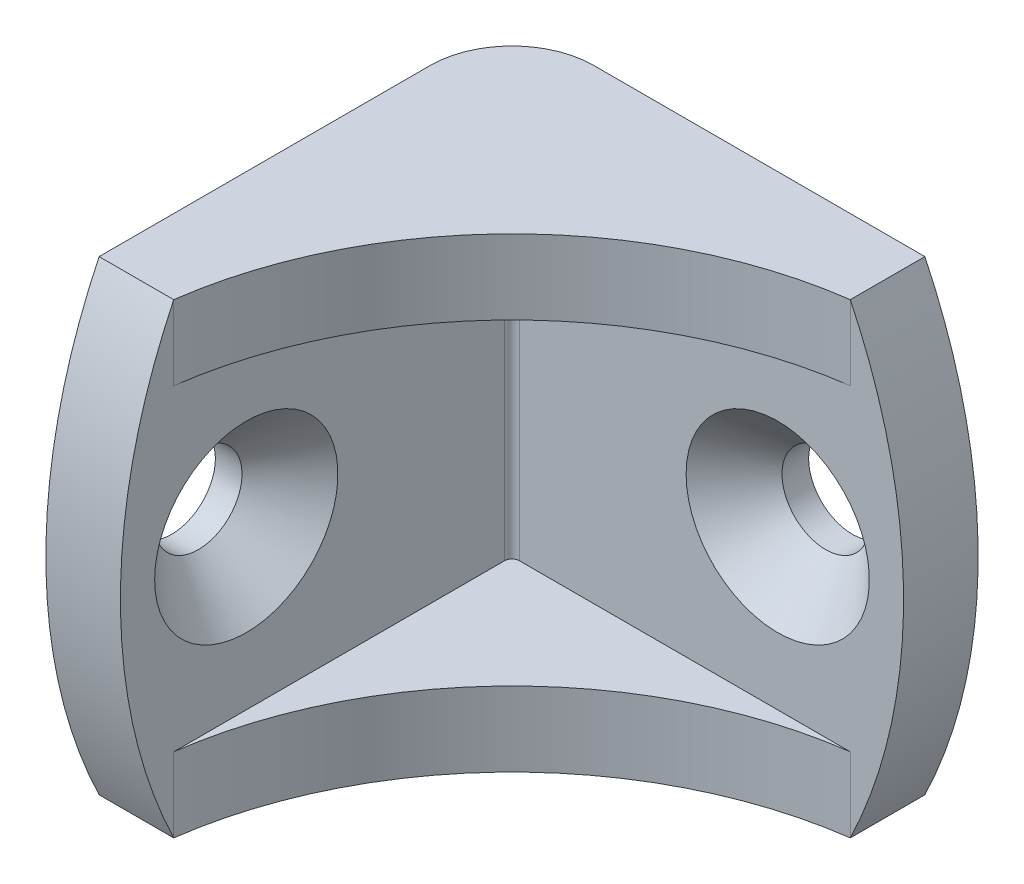
from build123d import *

# Parameters (mm, degrees)
EXTRUDE_THIN1_START = -11.1125
EXTRUDE_THIN1_DEPTH = 22.225
EXTRUDE4_START      = -3.556
EXTRUDE4_DEPTH      = 3.556
SKETCH4_R           = 2.0828
CUT_EXTRUDE1_DEPTH  = 34.3375
CUT_EXTRUDE2_DEPTH  = 32.080055377
CHAMFER1_SIZE       = 2.286


# Read off the part's stored shape, not the designer's step: Extrude-Thin1
with BuildPart() as part:
    # Extrude-Thin1 outline → Extrude-Thin1 (new body)
    with BuildSketch(Plane(origin=(0, 0, 0), x_dir=(1, 0, 0), z_dir=(0, 1, 0)).offset(EXTRUDE_THIN1_START)):
        with BuildLine():
            Line((3.9116, -3.556), (22.225, -3.556))
            Line((22.225, -3.556), (22.225, 0))
            Line((22.225, 0), (3.9116, 0))
            ThreePointArc((3.9116, 0), (1.145681115, -1.145681115), (0, -3.9116))
            Line((0, -3.9116), (0, -22.225))
            Line((0, -22.225), (3.556, -22.225))
            Line((3.556, -22.225), (3.556, -3.9116))
            ThreePointArc((3.556, -3.9116), (3.660152829, -3.660152829), (3.9116, -3.556))
        make_face()
    extrude(amount=EXTRUDE_THIN1_DEPTH)

    # Sketch5 → Extrude4 (add)
    with BuildSketch(Plane(origin=(0, 11.1125, 0), x_dir=(1, 0, 0), z_dir=(0, 1, 0)).offset(EXTRUDE4_START)):
        with BuildLine():
            Line((3.9116, -3.556), (19.685, -3.556))
            ThreePointArc((19.685, -3.556), (8.902403387, -8.902403387), (3.556, -19.685))
            Line((3.556, -19.685), (3.556, -3.9116))
            ThreePointArc((3.556, -3.9116), (3.660152829, -3.660152829), (3.9116, -3.556))
        make_face()
    extrude4 = extrude(amount=EXTRUDE4_DEPTH)

    # Mirror2: Extrude4 across plane
    add(extrude4.mirror(Plane.ZX))

    # Sketch4 → Cut-Extrude1 (cut, through all)
    with BuildSketch(Plane(origin=(0, 0, 0), x_dir=(0, 0, -1), z_dir=(1, 0, 0))):
        with Locations(Location((-16.225, 0, 0), (0, 0, 180))):
            Circle(SKETCH4_R)
    cut_extrude1 = extrude(amount=CUT_EXTRUDE1_DEPTH, mode=Mode.SUBTRACT)

    # Sketch6 → Cut-Extrude2 (cut, symmetric)
    with BuildSketch(Plane(origin=(3.556, 0, 0), x_dir=(0, 0, -1), z_dir=(1, 0, 0))):
        with BuildLine():
            Line((10.456138589, 73.60153911), (-19.685, 11.1125))
            ThreePointArc((-19.685, 11.1125), (-22.225, 0), (-19.685, -11.1125))
            Line((-19.685, -11.1125), (10.456138589, -73.60153911))
            Line((10.456138589, -73.60153911), (-128.300745843, -73.60153911))
            Line((-128.300745843, -73.60153911), (-128.300745843, 73.60153911))
            Line((-128.300745843, 73.60153911), (10.456138589, 73.60153911))
        make_face()
    cut_extrude2 = extrude(amount=CUT_EXTRUDE2_DEPTH, both=True, mode=Mode.SUBTRACT)

    # Mirror3: Cut-Extrude1, Cut-Extrude2 across plane
    add(cut_extrude1.mirror(Plane(origin=(0, 0, 0), x_dir=(0.7071067811865465, 0, 0.7071067811865486), z_dir=(-0.7071067811865488, 0, 0.7071067811865464))), mode=Mode.SUBTRACT)
    add(cut_extrude2.mirror(Plane(origin=(0, 0, 0), x_dir=(0.7071067811865465, 0, 0.7071067811865486), z_dir=(-0.7071067811865488, 0, 0.7071067811865464))), mode=Mode.SUBTRACT)

    # Chamfer1
    chamfer1_edges = [part.edges().sort_by_distance(p)[0] for p in [
        (3.556, 0, 14.1422),
        (14.1422, 0, 3.556),
    ]]
    chamfer(chamfer1_edges, length=CHAMFER1_SIZE)


solid = part.part
